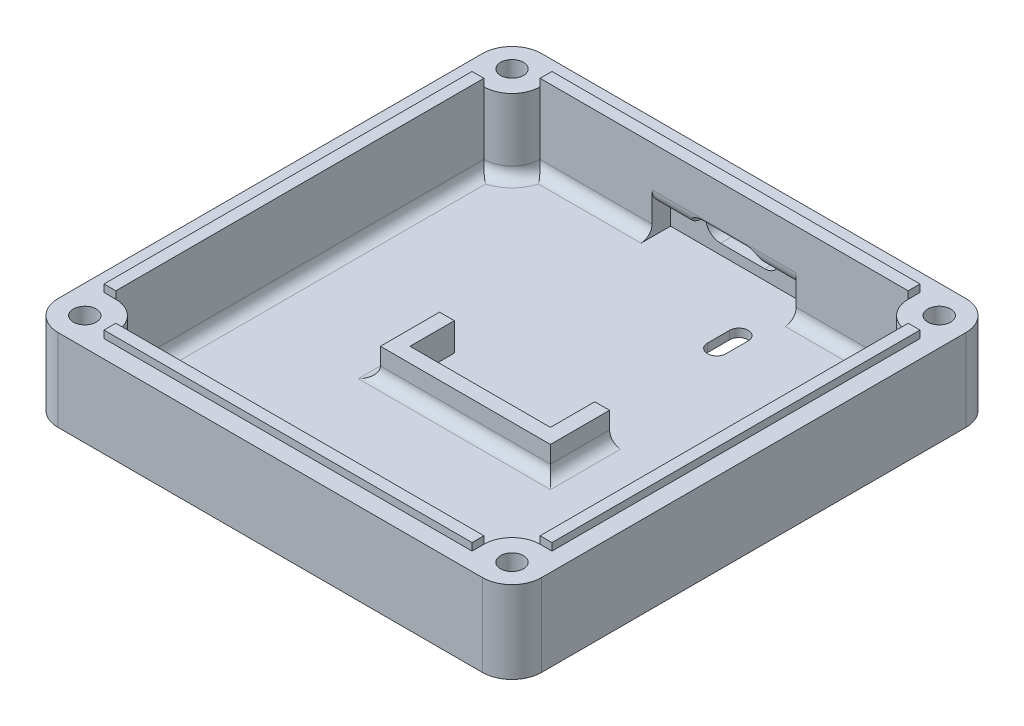
from build123d import *

# Parameters (mm, degrees)
SKETCH1_W           = 65.4
SKETCH1_H           = 65.4
BOSS_EXTRUDE1_DEPTH = 1.12
FILLET1_R           = 4
BOSS_EXTRUDE2_START = 10
BOSS_EXTRUDE2_DEPTH = 10
CUT_EXTRUDE1_REACH  = 75.96
SKETCH4_W           = 19.5
SKETCH4_H           = 3.5
CUT_EXTRUDE2_DEPTH  = 2.5
FILLET3_R           = 2
SKETCH5_W           = 1.6
SKETCH5_H           = 49.8
SKETCH5_W_2         = 49.8
SKETCH5_H_2         = 1.6
BOSS_EXTRUDE3_DEPTH = 1
BOSS_EXTRUDE4_DEPTH = 3.8
SKETCH7_R           = 1.55
CUT_EXTRUDE3_DEPTH  = 11.12
SKETCH8_R           = 2.75
CUT_EXTRUDE4_DEPTH  = 4
FILLET4_R           = 1.5
FILLET5_R           = 1.5
CUT_EXTRUDE5_REACH  = 49.807


with BuildPart() as part:
    # Sketch1 → Boss-Extrude1 (new body)
    with BuildSketch(Plane(origin=(0, 0, 0), x_dir=(1, 0, 0), z_dir=(0, 1, 0))):
        Rectangle(SKETCH1_W, SKETCH1_H)
    extrude(amount=BOSS_EXTRUDE1_DEPTH)

    # Fillet1
    fillet1_edges = [part.edges().sort_by_distance(p)[0] for p in [
        (32.7, 0.56, 32.7),
        (-32.7, 0.56, 32.7),
        (-32.7, 0.56, -32.7),
        (32.7, 0.56, -32.7),
    ]]
    fillet(fillet1_edges, radius=FILLET1_R)

    # Sketch2 → Boss-Extrude2 (add)
    with BuildSketch(Plane(origin=(0, 1.12, 0), x_dir=(1, 0, 0), z_dir=(0, 1, 0)).offset(BOSS_EXTRUDE2_START)):
        with BuildLine():
            Line((-32.7, 28.7), (-32.7, -28.7))
            ThreePointArc((-32.7, -28.7), (-31.528427125, -31.528427125), (-28.7, -32.7))
            Line((-28.7, -32.7), (28.7, -32.7))
            ThreePointArc((28.7, -32.7), (31.528427125, -31.528427125), (32.7, -28.7))
            Line((32.7, -28.7), (32.7, 28.7))
            ThreePointArc((32.7, 28.7), (31.528427125, 31.528427125), (28.7, 32.7))
            Line((28.7, 32.7), (-28.7, 32.7))
            ThreePointArc((-28.7, 32.7), (-31.528427125, 31.528427125), (-32.7, 28.7))
        make_face()
        with BuildLine():
            Line((24.9, 28.7), (-24.9, 28.7))
            ThreePointArc((-24.9, 28.7), (-26.012994231, 26.012994231), (-28.7, 24.9))
            Line((-28.7, 24.9), (-28.7, -24.9))
            ThreePointArc((-28.7, -24.9), (-26.012994231, -26.012994231), (-24.9, -28.7))
            Line((-24.9, -28.7), (24.9, -28.7))
            ThreePointArc((24.9, -28.7), (26.012994231, -26.012994231), (28.7, -24.9))
            Line((28.7, -24.9), (28.7, 24.9))
            ThreePointArc((28.7, 24.9), (26.012994231, 26.012994231), (24.9, 28.7))
        make_face(mode=Mode.SUBTRACT)
    extrude(amount=-BOSS_EXTRUDE2_DEPTH)

    # Sketch3 → Cut-Extrude1 (cut, up to next)
    with BuildSketch(Plane(origin=(0, 0, -32.7), x_dir=(-1, 0, 0), z_dir=(0, 0, -1)), mode=Mode.PRIVATE) as cut_extrude1_sk1:
        with BuildLine():
            Line((-3, 6.5), (3, 6.5))
            ThreePointArc((3, 6.5), (5, 4.5), (3, 2.5))
            Line((3, 2.5), (-3, 2.5))
            ThreePointArc((-3, 2.5), (-5, 4.5), (-3, 6.5))
        make_face()
    cut_extrude1_tool1 = extrude(cut_extrude1_sk1.sketch, amount=-CUT_EXTRUDE1_REACH, mode=Mode.PRIVATE) & part.part
    add(cut_extrude1_tool1.solids().sort_by_distance((0, 4.5, -32.7))[0], mode=Mode.SUBTRACT)

    # Sketch4 → Cut-Extrude2 (cut)
    with BuildSketch(Plane.XY.offset(-28.7)):
        with Locations((0, 2.87)):
            Rectangle(SKETCH4_W, SKETCH4_H)
    extrude(amount=-CUT_EXTRUDE2_DEPTH, mode=Mode.SUBTRACT)

    # Fillet3
    # the kernel refuses this fillet: 2 mm, written as the material it takes off along each edge
    with BuildSketch(Plane(origin=(-0.003603246, 4.62, -28.7), x_dir=(0, 1, 0), z_dir=(1, 0, 0)), Plane(origin=(-9.75, 4.62, -28.7), x_dir=(0, 1, 0), z_dir=(1, 0, 0))) as fillet3_piece_1:
        with BuildLine():
            CenterArc((FILLET3_R, -FILLET3_R), FILLET3_R, 90, 90)
            Line((0, -FILLET3_R), (0, 0))
            Line((0, 0), (FILLET3_R, 0))
        make_face()
    extrude(amount=9.753603246, mode=Mode.SUBTRACT)

    # Sketch5 → Boss-Extrude3 (add)
    with BuildSketch(Plane(origin=(0, 11.12, 0), x_dir=(1, 0, 0), z_dir=(0, 1, 0))):
        with Locations((-29.5, 0)):
            Rectangle(SKETCH5_W, SKETCH5_H)
        with Locations((0, -29.5)):
            Rectangle(SKETCH5_W_2, SKETCH5_H_2)
        with Locations((29.5, 0)):
            Rectangle(SKETCH5_W, SKETCH5_H)
        with Locations((0, 29.5)):
            Rectangle(SKETCH5_W_2, SKETCH5_H_2)
    extrude(amount=BOSS_EXTRUDE3_DEPTH)

    # Sketch6 → Boss-Extrude4 (add)
    with BuildSketch(Plane(origin=(0, 1.12, 0), x_dir=(1, 0, 0), z_dir=(0, 1, 0))):
        Polygon((-9.5, -4.3), (9.5, -4.3), (9.5, 1.7), (11.5, 1.7), (11.5, -6.3), (-11.5, -6.3), (-11.5, 1.7), (-9.5, 1.7), align=None)
    extrude(amount=BOSS_EXTRUDE4_DEPTH)

    # Sketch7 → Cut-Extrude3 (cut)
    with BuildSketch(Plane(origin=(0, 11.12, 0), x_dir=(1, 0, 0), z_dir=(0, 1, 0))):
        with Locations(Location((-28.9, 28.9, 0), (0, 0, 270))):
            Circle(SKETCH7_R)
        with Locations(Location((28.9, 28.9, 0), (0, 0, 270))):
            Circle(SKETCH7_R)
        with Locations(Location((28.9, -28.9, 0), (0, 0, 270))):
            Circle(SKETCH7_R)
        with Locations(Location((-28.9, -28.9, 0), (0, 0, 270))):
            Circle(SKETCH7_R)
    extrude(amount=-CUT_EXTRUDE3_DEPTH, mode=Mode.SUBTRACT)

    # Sketch8 → Cut-Extrude4 (cut)
    with BuildSketch(Plane.XZ):
        with Locations(Location((-28.9, 28.9, 0), (0, 0, 270))):
            Circle(SKETCH8_R)
        with Locations(Location((28.9, 28.9, 0), (0, 0, 270))):
            Circle(SKETCH8_R)
        with Locations(Location((28.9, -28.9, 0), (0, 0, 270))):
            Circle(SKETCH8_R)
        with Locations(Location((-28.9, -28.9, 0), (0, 0, 270))):
            Circle(SKETCH8_R)
    extrude(amount=-CUT_EXTRUDE4_DEPTH, mode=Mode.SUBTRACT)

    # Fillet4
    fillet4_edges = [part.edges().sort_by_distance(p)[0] for p in [
        (-11.5, 1.12, 2.3),
        (0, 1.12, 6.3),
        (11.5, 1.12, 2.3),
    ]]
    fillet(fillet4_edges, radius=FILLET4_R)

    # Fillet5
    fillet5_edges = [part.edges().sort_by_distance(p)[0] for p in [
        (-17.325, 1.12, -28.7),
        (26.012994231, 1.12, -26.012994231),
        (17.325, 1.12, -28.7),
        (-26.012994231, 1.12, -26.012994231),
        (-28.7, 1.12, 0),
        (-26.012994231, 1.12, 26.012994231),
        (0, 1.12, 28.7),
        (26.012994231, 1.12, 26.012994231),
        (28.7, 1.12, 0),
    ]]
    fillet(fillet5_edges, radius=FILLET5_R)

    # Sketch9 → Cut-Extrude5 (cut, up to next)
    with BuildSketch(Plane.XZ, mode=Mode.PRIVATE) as cut_extrude5_sk1:
        with BuildLine():
            Line((6.45, -23), (6.45, -20))
            ThreePointArc((6.45, -20), (7.7, -18.75), (8.95, -20))
            Line((8.95, -20), (8.95, -23))
            ThreePointArc((8.95, -23), (7.7, -24.25), (6.45, -23))
        make_face()
    cut_extrude5_tool1 = extrude(cut_extrude5_sk1.sketch, amount=-CUT_EXTRUDE5_REACH, mode=Mode.PRIVATE) & part.part
    add(cut_extrude5_tool1.solids().sort_by_distance((7.7, 0, -21.5))[0], mode=Mode.SUBTRACT)


solid = part.part
